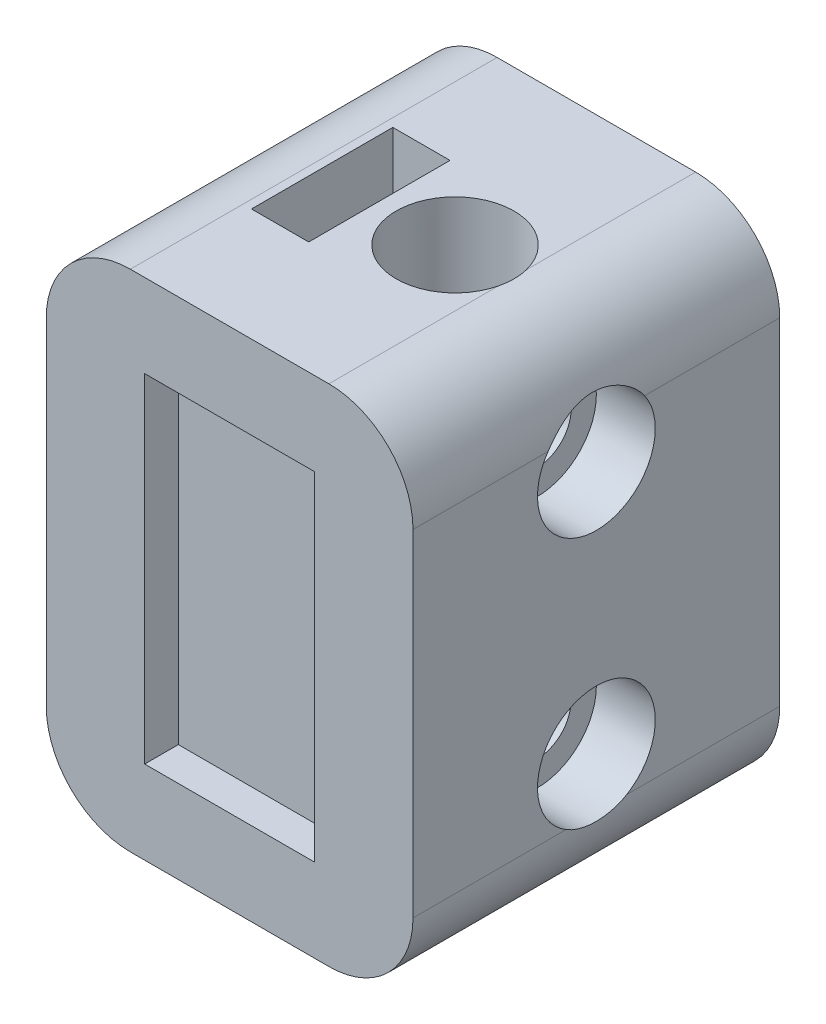
from build123d import *

# Parameters (mm, degrees)
CROQUIS1_W                        = 21.8
CROQUIS1_H                        = 30
SALIENTE_EXTRUIR1_DEPTH           = 21.8
CROQUIS6_R                        = 2
CORTAR_EXTRUIR2_DEPTH             = 21.8
CORTAR_EXTRUIR4_REACH             = 45.017
CROQUIS11_R                       = 3.5
CROQUIS11_W                       = 3.4
CROQUIS11_H                       = 8.4
CORTAR_EXTRUIR4_DIRECTION_2_DEPTH = 3.5
REDONDEO1_R                       = 5
CROQUIS13_R                       = 3.5
CORTAR_EXTRUIR6_DEPTH             = 3.5
CROQUIS16_W                       = 10.1
CROQUIS16_H                       = 20.1
CORTAR_EXTRUIR7_DEPTH             = 2
CROQUIS17_W                       = 10.1
CROQUIS17_H                       = 20.1
CORTAR_EXTRUIR8_DEPTH             = 2
CORTAR_EXTRUIR9_START             = -3.5
CROQUIS7_R                        = 3.5
CORTAR_EXTRUIR9_DEPTH             = 3.5


with BuildPart() as part:
    # Croquis1 → Saliente-Extruir1 (new body)
    with BuildSketch(Plane(origin=(0, 0, 0), x_dir=(0, 0, -1), z_dir=(1, 0, 0))):
        with Locations((-10.9, -15)):
            Rectangle(CROQUIS1_W, CROQUIS1_H)
    extrude(amount=SALIENTE_EXTRUIR1_DEPTH)

    # Croquis6 → Cortar-Extruir2 (cut)
    with BuildSketch(Plane.ZY):
        with Locations((10.9, -22)):
            Circle(CROQUIS6_R)
        with Locations((10.9, -7)):
            Circle(CROQUIS6_R)
    extrude(amount=-CORTAR_EXTRUIR2_DEPTH, mode=Mode.SUBTRACT)

    # Cortar-Extruir4: up to this face of the body (flat: up to its plane)
    cortar_extruir4_end = Plane(part.part.faces().sort_by_distance((10.9, 0, 10.9))[0])
    # Croquis11 → Cortar-Extruir4 (cut, up to the picked face)
    with BuildSketch(Plane.XZ.offset(30), mode=Mode.PRIVATE) as cortar_extruir4_sk1:
        with Locations(Location((13.4, 10.9, 0), (0, 0, 270))):
            Circle(CROQUIS11_R)
    cortar_extruir4_tool1 = split(extrude(cortar_extruir4_sk1.sketch, amount=-CORTAR_EXTRUIR4_REACH, mode=Mode.PRIVATE), bisect_by=cortar_extruir4_end, keep=Keep.BOTH, mode=Mode.PRIVATE)
    # Croquis11 → Cortar-Extruir4 (cut, up to the picked face)
    with BuildSketch(Plane.XZ.offset(30), mode=Mode.PRIVATE) as cortar_extruir4_sk2:
        with Locations((7.2, 10.9)):
            Rectangle(CROQUIS11_W, CROQUIS11_H)
    cortar_extruir4_tool2 = split(extrude(cortar_extruir4_sk2.sketch, amount=-CORTAR_EXTRUIR4_REACH, mode=Mode.PRIVATE), bisect_by=cortar_extruir4_end, keep=Keep.BOTH, mode=Mode.PRIVATE)
    add(cortar_extruir4_tool1.solids().sort_by(Axis((13.4, -30, 10.9), (0, 1, 0)))[0], mode=Mode.SUBTRACT)
    add(cortar_extruir4_tool2.solids().sort_by(Axis((7.2, -30, 10.9), (0, 1, 0)))[0], mode=Mode.SUBTRACT)

    # Croquis11 → Cortar-Extruir4 direction 2 (cut)
    with BuildSketch(Plane.XZ.offset(30)):
        with Locations(Location((13.4, 10.9, 0), (0, 0, 270))):
            Circle(CROQUIS11_R)
        with Locations((7.2, 10.9)):
            Rectangle(CROQUIS11_W, CROQUIS11_H)
    extrude(amount=CORTAR_EXTRUIR4_DIRECTION_2_DEPTH, mode=Mode.SUBTRACT)

    # Redondeo1
    # the kernel refuses this fillet: 5 mm, written as the material it takes off along each edge
    with BuildSketch(Plane(origin=(21.8, -30, 34.3), x_dir=(0, 1, 0), z_dir=(0, 0, -1)), Plane(origin=(0, 0, -12.5), x_dir=(1, 0, 0), z_dir=(0, 0, 1))) as redondeo1_piece_1:
        with BuildLine():
            CenterArc((REDONDEO1_R, -REDONDEO1_R), REDONDEO1_R, 90, 90)
            Line((0, -REDONDEO1_R), (0, 0))
            Line((0, 0), (REDONDEO1_R, 0))
        make_face()
    extrude(amount=46.8, mode=Mode.SUBTRACT)
    with BuildSketch(Plane(origin=(21.8, 0, -12.5), x_dir=(-1, 0, 0), z_dir=(0, 0, 1)), Plane(origin=(0, -30, 34.3), x_dir=(0, 1, 0), z_dir=(0, 0, -1))) as redondeo1_piece_2:
        with BuildLine():
            CenterArc((REDONDEO1_R, REDONDEO1_R), REDONDEO1_R, 180, 90)
            Line((0, REDONDEO1_R), (0, 0))
            Line((0, 0), (REDONDEO1_R, 0))
        make_face()
    extrude(amount=46.8, mode=Mode.SUBTRACT)

    # Croquis13 → Cortar-Extruir6 (cut)
    with BuildSketch(Plane.ZY):
        with Locations((10.9, -7)):
            Circle(CROQUIS13_R)
        with Locations(Location((10.9, -22, 0), (0, 0, 301.002719134))):
            Circle(CROQUIS13_R)
    extrude(amount=-CORTAR_EXTRUIR6_DEPTH, mode=Mode.SUBTRACT)

    # Croquis16 → Cortar-Extruir7 (cut)
    with BuildSketch(Plane.XY.offset(21.8)):
        with Locations((10.9, -15)):
            Rectangle(CROQUIS16_W, CROQUIS16_H)
    extrude(amount=-CORTAR_EXTRUIR7_DEPTH, mode=Mode.SUBTRACT)

    # Croquis17 → Cortar-Extruir8 (cut)
    with BuildSketch(Plane(origin=(0, 0, 0), x_dir=(-1, 0, 0), z_dir=(0, 0, -1))):
        with Locations((-10.9, -15)):
            Rectangle(CROQUIS17_W, CROQUIS17_H)
    extrude(amount=-CORTAR_EXTRUIR8_DEPTH, mode=Mode.SUBTRACT)

    # Croquis7 → Cortar-Extruir9 (cut)
    with BuildSketch(Plane(origin=(21.8, 0, 0), x_dir=(0, 0, -1), z_dir=(1, 0, 0)).offset(CORTAR_EXTRUIR9_START)):
        with Locations(Location((-10.9, -22, 0), (0, 0, 238.997280866))):
            Circle(CROQUIS7_R)
        with Locations(Location((-10.9, -7, 0), (0, 0, 180))):
            Circle(CROQUIS7_R)
    extrude(amount=CORTAR_EXTRUIR9_DEPTH, mode=Mode.SUBTRACT)


solid = part.part
